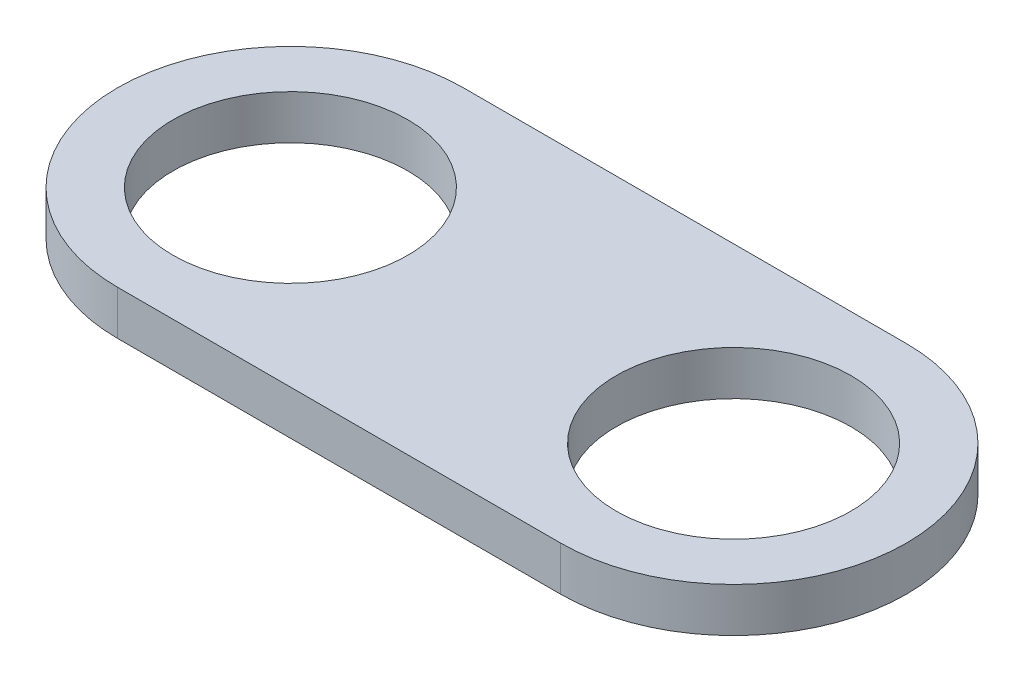
from build123d import *

# Parameters (mm, degrees)
SKETCH1_R           = 5.3
BOSS_EXTRUDE1_DEPTH = 2


with BuildPart() as part:
    # Sketch1 → Boss-Extrude1 (new body)
    with BuildSketch(Plane(origin=(0, 0, 0), x_dir=(1, 0, 0), z_dir=(0, 1, 0))):
        with BuildLine():
            Line((-10, 7.8), (10, 7.8))
            ThreePointArc((10, 7.8), (17.8, 0), (10, -7.8))
            Line((10, -7.8), (-10, -7.8))
            ThreePointArc((-10, -7.8), (-17.8, 0), (-10, 7.8))
        make_face()
        with Locations((-10, 0)):
            Circle(SKETCH1_R, mode=Mode.SUBTRACT)
        with Locations((10, 0)):
            Circle(SKETCH1_R, mode=Mode.SUBTRACT)
    extrude(amount=BOSS_EXTRUDE1_DEPTH)


solid = part.part
